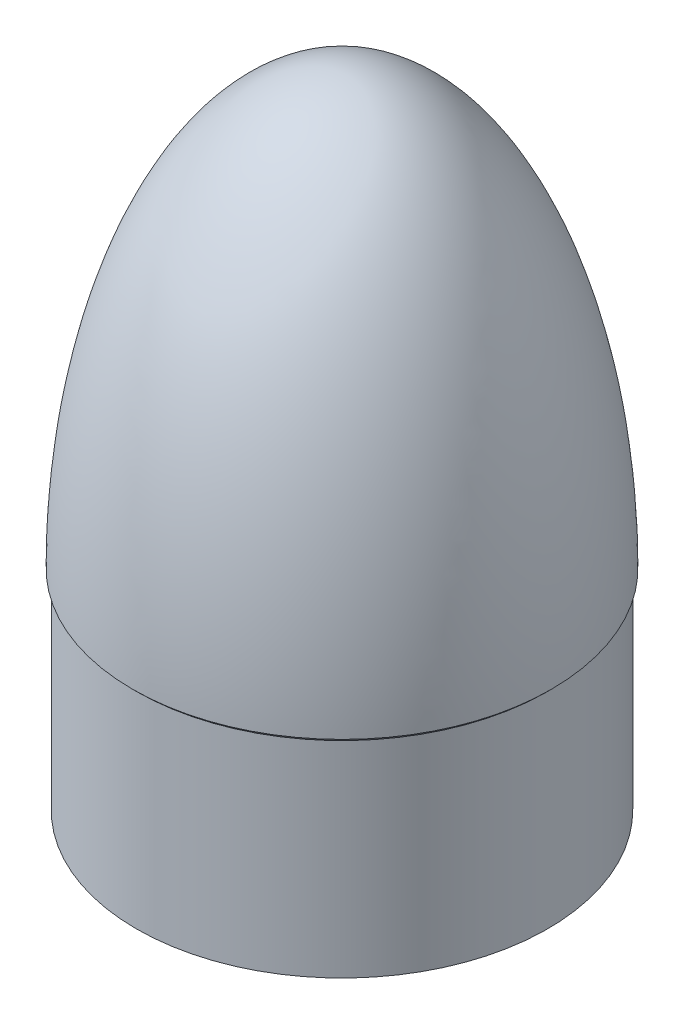
from build123d import *


with BuildPart() as part:
    # Sketch1 → Revolve1 (revolve)
    with BuildSketch(Plane.XY):
        with BuildLine():
            Line((0, 165.1), (0, 163.9))
            add(Edge.make_bspline(
                [(79.557028794, 3.179228794), (78.043196114, 163.9), (0, 163.9)],
                knots=[4.731787566, 4.731787566, 4.731787566, 6.283185307, 6.283185307, 6.283185307], degree=2, weights=[1, 0.713931849, 1]))
            Line((79.557028794, 3.179228794), (76.3778, 0))
            Line((76.3778, 0), (76.3778, -80.772))
            Line((76.3778, -80.772), (79.375, -80.772))
            Line((79.375, -80.772), (79.375, -1.397))
            Line((79.375, -1.397), (80.772, 0))
            add(Edge.make_bspline(
                [(80.772, 0), (80.772, 165.1), (0, 165.1)],
                knots=[1.570796327, 1.570796327, 1.570796327, 3.141592654, 3.141592654, 3.141592654], degree=2, weights=[1, 0.707106781, 1]))
        make_face()
    revolve(axis=Axis((0, 165.1, 0), (0, -1, 0)))


solid = part.part
